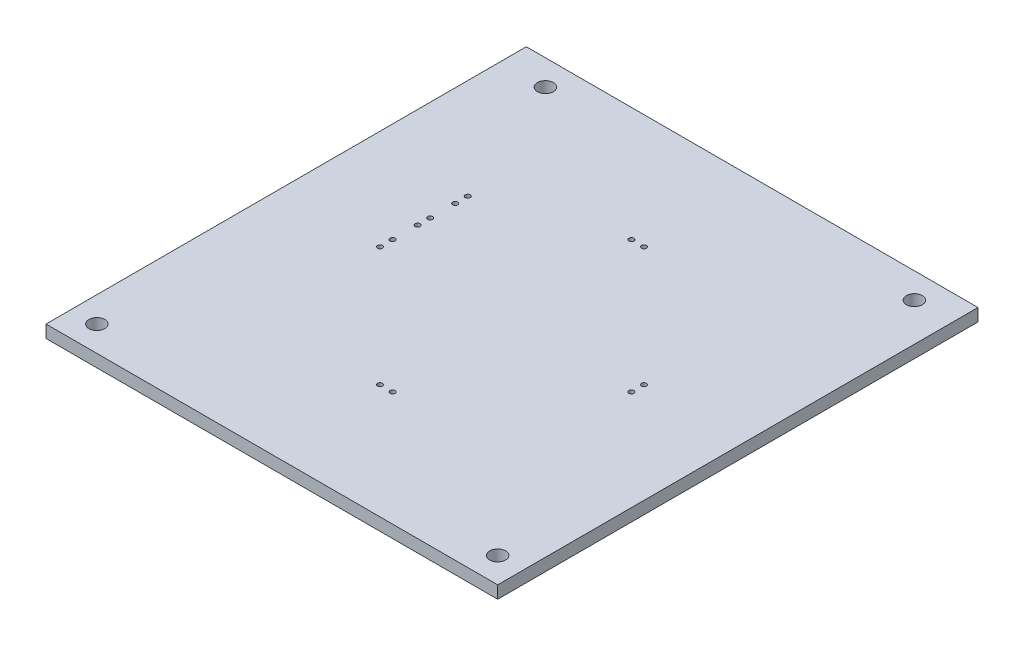
from build123d import *

# Parameters (mm, degrees)
SKETCH1_W           = 90.17
SKETCH1_H           = 95.885
BOSS_EXTRUDE1_DEPTH = 2.5
SKETCH2_R           = 1.5875
CUT_EXTRUDE1_DEPTH  = 2.5
SKETCH3_R           = 0.5
CUT_EXTRUDE2_DEPTH  = 10
CIRPATTERN1_COUNT   = 4
LPATTERN1_COUNT     = 3
LPATTERN1_PITCH     = 7.5


with BuildPart() as part:
    # Sketch1 → Boss-Extrude1 (new body)
    with BuildSketch(Plane(origin=(0, 0, 0), x_dir=(1, 0, 0), z_dir=(0, 1, 0))):
        Rectangle(SKETCH1_W, SKETCH1_H)
    extrude(amount=BOSS_EXTRUDE1_DEPTH)

    # Sketch2 → Cut-Extrude1 (cut)
    with BuildSketch(Plane(origin=(0, 2.5, 0), x_dir=(1, 0, 0), z_dir=(0, 1, 0))):
        with Locations((-40.005, -42.8625)):
            Circle(SKETCH2_R)
        with Locations((-36.195, 42.8625)):
            Circle(SKETCH2_R)
        with Locations((37.465, 42.8625)):
            Circle(SKETCH2_R)
        with Locations((40.005, -42.8625)):
            Circle(SKETCH2_R)
    extrude(amount=-CUT_EXTRUDE1_DEPTH, mode=Mode.SUBTRACT)

    # Sketch3 → Cut-Extrude2 (cut)
    with BuildSketch(Plane(origin=(0, 2.5, 0), x_dir=(1, 0, 0), z_dir=(0, 1, 0))):
        with Locations((-25.085, 1.25)):
            Circle(SKETCH3_R)
        with Locations((-25.085, -1.25)):
            Circle(SKETCH3_R)
    cut_extrude2 = extrude(amount=-CUT_EXTRUDE2_DEPTH, mode=Mode.SUBTRACT)

    # CirPattern1: Cut-Extrude2 ×4 about axis
    cirpattern1_axis = Axis((0, 50, 0), (0, -1, 0))
    for i in range(1, CIRPATTERN1_COUNT):
        add(cut_extrude2.rotate(cirpattern1_axis, i * 360 / CIRPATTERN1_COUNT), mode=Mode.SUBTRACT)

    # LPattern1: Cut-Extrude2 ×3
    with Locations(*[(0, 0, -i * LPATTERN1_PITCH) for i in range(1, LPATTERN1_COUNT)]):
        add(cut_extrude2, mode=Mode.SUBTRACT)


solid = part.part
